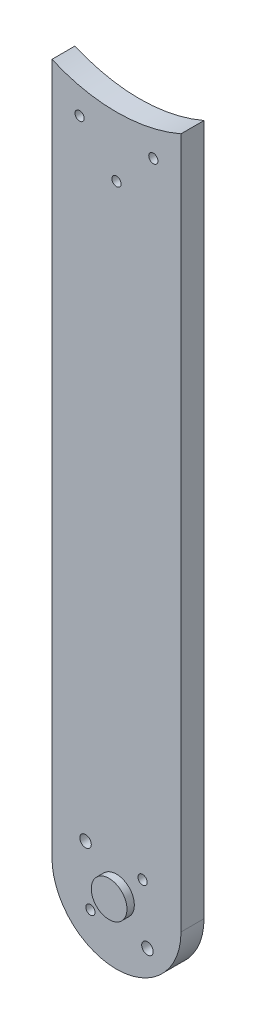
from build123d import *

# Parameters (mm, degrees)
SKETCH1_R           = 1
SKETCH1_R_2         = 1.25
BOSS_EXTRUDE1_DEPTH = 5
SKETCH2_R           = 3.875
BOSS_EXTRUDE2_DEPTH = 1.6


with BuildPart() as part:
    # Sketch1 → Boss-Extrude1 (new body)
    with BuildSketch(Plane.XY):
        with BuildLine():
            Line((-14, 0), (-14, 150))
            ThreePointArc((-14, 150), (0, 147.078029865), (14, 150))
            Line((14, 150), (14, 0))
            ThreePointArc((14, 0), (0, -14), (-14, 0))
        make_face()
        with Locations((-8, 142.376014802)):
            Circle(SKETCH1_R, mode=Mode.SUBTRACT)
        with Locations((6.72, -6.72)):
            Circle(SKETCH1_R_2, mode=Mode.SUBTRACT)
        with Locations((-5.656854249, -5.656854249)):
            Circle(SKETCH1_R, mode=Mode.SUBTRACT)
        with Locations((5.656854249, 5.656854249)):
            Circle(SKETCH1_R, mode=Mode.SUBTRACT)
        with Locations((-6.717514421, 6.717514421)):
            Circle(SKETCH1_R_2, mode=Mode.SUBTRACT)
        with Locations((8, 142.376014802)):
            Circle(SKETCH1_R, mode=Mode.SUBTRACT)
        with Locations((0, 134.072949104)):
            Circle(SKETCH1_R, mode=Mode.SUBTRACT)
    extrude(amount=BOSS_EXTRUDE1_DEPTH)

    # Sketch2 → Boss-Extrude2 (add)
    with BuildSketch(Plane.XY.offset(5)):
        Circle(SKETCH2_R)
    extrude(amount=BOSS_EXTRUDE2_DEPTH)


solid = part.part
